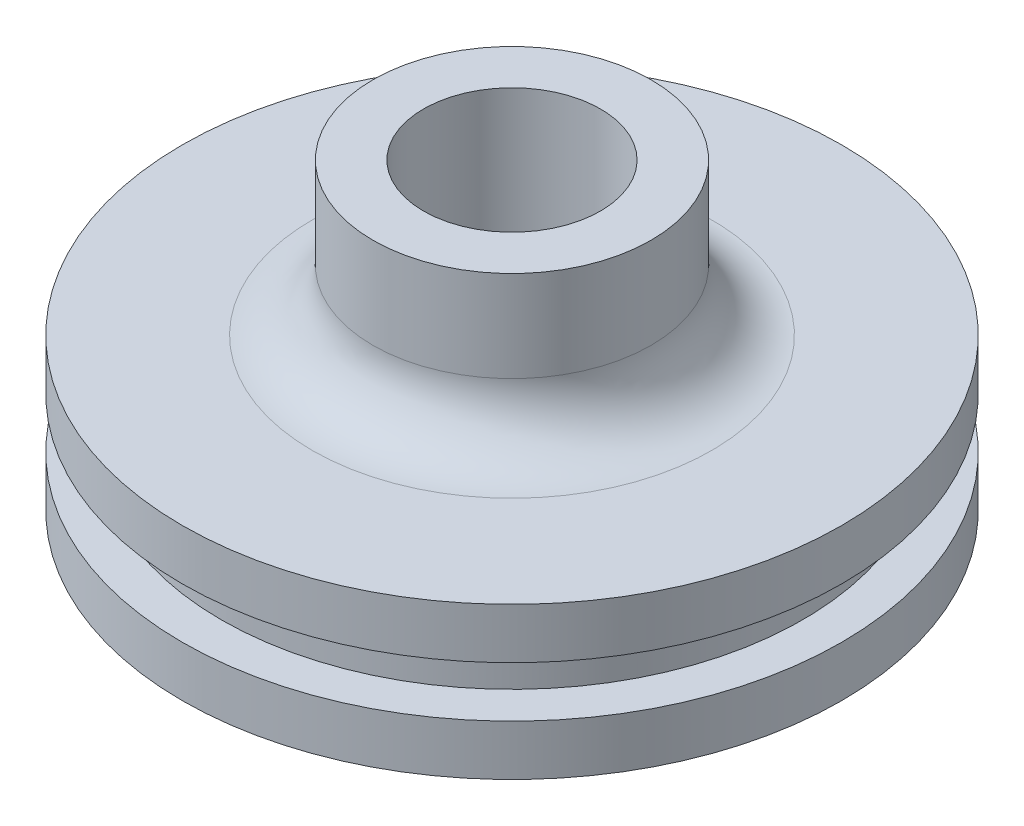
from build123d import *


with BuildPart() as part:
    # Sketch2 → base (revolve)
    with BuildSketch(Plane.XY):
        with BuildLine():
            Line((-20.701, 0), (-20.701, -3.175))
            Line((-20.701, -3.175), (-18.25625, -3.175))
            Line((-18.25625, -3.175), (-18.25625, -6.35))
            Line((-18.25625, -6.35), (-20.701, -6.35))
            Line((-20.701, -6.35), (-20.701, -9.525))
            Line((-20.701, -9.525), (-1.5875, -9.525))
            Line((-1.5875, -9.525), (-1.5875, -3.175))
            Line((-1.5875, -3.175), (-5.55625, -3.175))
            Line((-5.55625, -3.175), (-5.55625, 9.525))
            Line((-5.55625, 9.525), (-8.73125, 9.525))
            Line((-8.73125, 9.525), (-8.73125, 3.81))
            ThreePointArc((-8.73125, 3.81), (-9.847173164, 1.115923164), (-12.54125, 0))
            Line((-12.54125, 0), (-20.701, 0))
        make_face()
    revolve(axis=Axis((0, 0, 0), (0, -1, 0)))


solid = part.part
